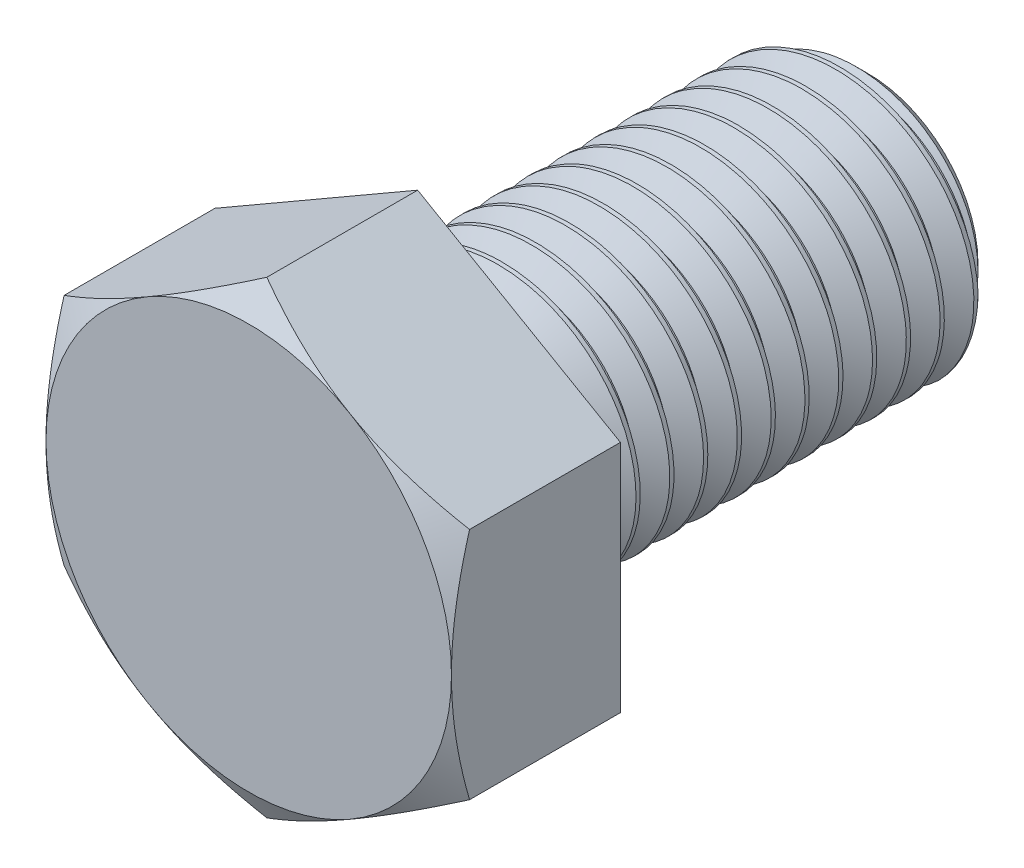
from build123d import *

# Parameters (mm, degrees)
BOSS_EXTRUDE1_DEPTH = 15
SKETCH4_OUTSIDE_W   = 270.026
SKETCH4_OUTSIDE_H   = 275.596
SKETCH4_OUTSIDE_R   = 18
CUT_EXTRUDE1_DEPTH  = 62.489836559
CUT_EXTRUDE1_DRAFT  = -60
CUT_SWEEP1_PITCH    = 3
CUT_SWEEP1_TO       = 40


with BuildPart() as part:
    # Sketch2 → Revolve1 (revolve)
    with BuildSketch(Plane(origin=(0, 0, 0), x_dir=(0, 0, -1), z_dir=(1, 0, 0)), mode=Mode.PRIVATE) as revolve1_sk:
        Polygon((-27.5, 18), (-27.5, 0), (27.5, 0), (27.5, 9.75), (25.25, 12), (-12.5, 12), (-12.5, 18), align=None)
    revolve(revolve1_sk.sketch.rotate(Axis((0, 0, 27.5), (0, 0, -1)), 90), axis=Axis((0, 0, 27.5), (0, 0, -1)))

    # Sketch3 → Boss-Extrude1 (add)
    with BuildSketch(Plane.XY.offset(27.5)):
        Polygon((0, 20.784609691), (-18, 10.392304845), (-18, -10.392304845), (0, -20.784609691), (18, -10.392304845), (18, 10.392304845), align=None)
    extrude(amount=-BOSS_EXTRUDE1_DEPTH)


with BuildPart() as cut_extrude1_tool:
    # Sketch4 outside → Cut-Extrude1 (with draft: the straight prism first)
    with BuildSketch(Plane.XY.offset(27.5)):
        Rectangle(SKETCH4_OUTSIDE_W, SKETCH4_OUTSIDE_H)
        Circle(SKETCH4_OUTSIDE_R, mode=Mode.SUBTRACT)
    extrude(amount=-CUT_EXTRUDE1_DEPTH)
    # Cut-Extrude1: the draft: its side faces are tilted about the plane it starts from
    cut_extrude1_sides = [cut_extrude1_tool.faces().sort_by_distance(p)[0] for p in [
        (0, -137.798, -3.744918279),
        (135.013, 0, -3.744918279),
        (0, 137.798, -3.744918279),
        (-135.013, 0, -3.744918279),
        (-18, 0, -3.744918279),
    ]]
    draft(cut_extrude1_sides, Plane.XY.offset(27.5), CUT_EXTRUDE1_DRAFT)


with BuildPart() as part_1:
    add(part.part)

    # Cut-Extrude1: cut by cut_extrude1_tool
    add(cut_extrude1_tool.part, mode=Mode.SUBTRACT)


with BuildPart() as body_2:
    # Split1: read off the stored shape, not the designer's step
    # Split1: the piece on the far side of the plane
    add(part_1.part)
    split(bisect_by=Plane.XY.offset(12.5), keep=Keep.BOTTOM)

    # Cut-Sweep1: arcs per turn and ends read off the stored shape
    # Cut-Sweep1: the profile of Sketch7 screwed along a right-hand helix through 14.333333 turns, 10 arcs to a turn; built about Z, then put on its axis
    cut_sweep1_z = Axis((0, 0, 0), (0, 0, 1))
    cut_sweep1_corners = [(12.162379763, 0, 0.09375), (10.051442841, 0, -1.125), (10.051442841, 0, -1.5), (12.162379763, 0, -2.71875)]
    with BuildLine(mode=Mode.PRIVATE) as cut_sweep1_profile:
        Line(cut_sweep1_corners[0], cut_sweep1_corners[1])
        Line(cut_sweep1_corners[1], cut_sweep1_corners[2])
        Line(cut_sweep1_corners[2], cut_sweep1_corners[3])
        Line(cut_sweep1_corners[3], cut_sweep1_corners[0])
    cut_sweep1_cap = Face(cut_sweep1_profile.wire())
    cut_sweep1_turn_angles = [0, 18, 36, 54, 72, 90, 108, 126, 144, 162, 180, 198, 216, 234, 252, 270, 288, 306, 324, 342, 360]
    cut_sweep1_turn_weights = [1, 0.9510565162951535, 1, 0.9510565162951535, 1, 0.9510565162951535, 1, 0.9510565162951535, 1, 0.9510565162951535, 1, 0.9510565162951535, 1, 0.9510565162951535, 1, 0.9510565162951535, 1, 0.9510565162951535, 1, 0.9510565162951535, 1]
    cut_sweep1_turn_rails = [Edge.make_bspline([Vector(p[0], p[1], 0).rotate(cut_sweep1_z, cut_sweep1_turn_angles[k]) / cut_sweep1_turn_weights[k] + Vector(0, 0, p[2] + CUT_SWEEP1_PITCH * cut_sweep1_turn_angles[k] / 360) for k in range(21)], [0, 0, 0, 1, 1, 2, 2, 3, 3, 4, 4, 5, 5, 6, 6, 7, 7, 8, 8, 9, 9, 10, 10, 10], 2, cut_sweep1_turn_weights) for p in cut_sweep1_corners]
    cut_sweep1_turn_sides = [Face.make_surface_from_curves(cut_sweep1_turn_rails[p[0]], cut_sweep1_turn_rails[p[1]]) for p in [(0, 1), (1, 2), (2, 3), (3, 0)]]
    cut_sweep1_last_angles = [5040, 5058, 5076, 5094, 5112, 5130, 5148, 5154, 5160]
    cut_sweep1_last_weights = [1, 0.9510565162951535, 1, 0.9510565162951535, 1, 0.9510565162951535, 1, 0.9945218953682758, 1]
    cut_sweep1_last_rails = [Edge.make_bspline([Vector(p[0], p[1], 0).rotate(cut_sweep1_z, cut_sweep1_last_angles[k]) / cut_sweep1_last_weights[k] + Vector(0, 0, p[2] + CUT_SWEEP1_PITCH * cut_sweep1_last_angles[k] / 360) for k in range(9)], [0, 0, 0, 1, 1, 2, 2, 3, 3, 4, 4, 4], 2, cut_sweep1_last_weights) for p in cut_sweep1_corners]
    cut_sweep1_last_sides = [Face.make_surface_from_curves(cut_sweep1_last_rails[p[0]], cut_sweep1_last_rails[p[1]]) for p in [(0, 1), (1, 2), (2, 3), (3, 0)]]
    cut_sweep1 = Plane(origin=(0, 0, -27.5), x_dir=(0, 1, 0), z_dir=(0, 0, 1)) * split(Solid(Shell([*[p.moved(Location((0, 0, CUT_SWEEP1_PITCH * i))) for i in range(14) for p in cut_sweep1_turn_sides], *cut_sweep1_last_sides, cut_sweep1_cap, cut_sweep1_cap.rotate(cut_sweep1_z, 5160).moved(Location((0, 0, CUT_SWEEP1_PITCH * 5160 / 360)))])), bisect_by=Plane.XY.offset(CUT_SWEEP1_TO), keep=Keep.BOTTOM, mode=Mode.PRIVATE)
    add(cut_sweep1, mode=Mode.SUBTRACT)


with BuildPart() as part_2:
    add(part_1.part)

    # Split1
    split(bisect_by=Plane.XY.offset(12.5), keep=Keep.TOP)

    add(body_2.part)  # Boss-Extrude2 merges body 2
    # Boss-Extrude2: read off the stored shape, not the designer's step
    # Boss-Extrude2 outline → Boss-Extrude2 (revolve)
    with BuildSketch(Plane.XZ):
        Polygon((10.051442606, 12.5), (10.051442606, 7.14638256), (12, 12.5), align=None)
    revolve(axis=Axis((0, 0, 0), (0, 0, 1)))


solid = part_2.part
